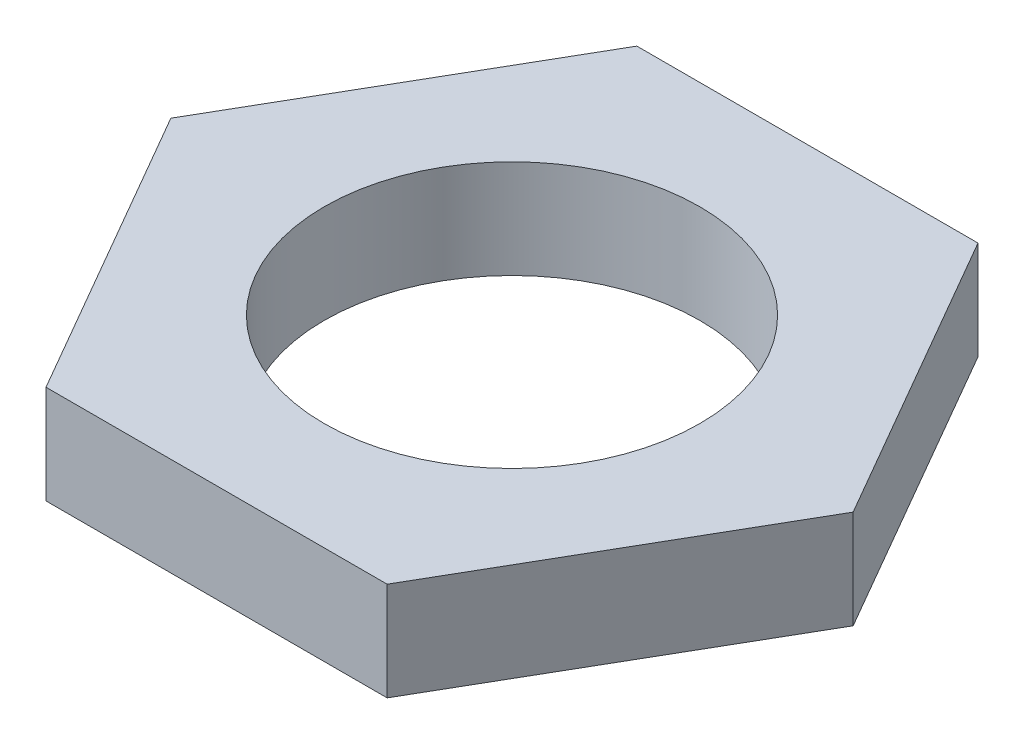
from build123d import *

# Parameters (mm, degrees)
SKETCH1_R           = 2.4795
BOSS_EXTRUDE1_DEPTH = 1.3


with BuildPart() as part:
    # Sketch1 → Boss-Extrude1 (new body)
    with BuildSketch(Plane(origin=(0, 0, 0), x_dir=(1, 0, 0), z_dir=(0, 1, 0))):
        Polygon((4.5033321, 0), (2.25166605, 3.9), (-2.25166605, 3.9), (-4.5033321, 0), (-2.25166605, -3.9), (2.25166605, -3.9), align=None)
        Circle(SKETCH1_R, mode=Mode.SUBTRACT)
    extrude(amount=BOSS_EXTRUDE1_DEPTH)


solid = part.part
